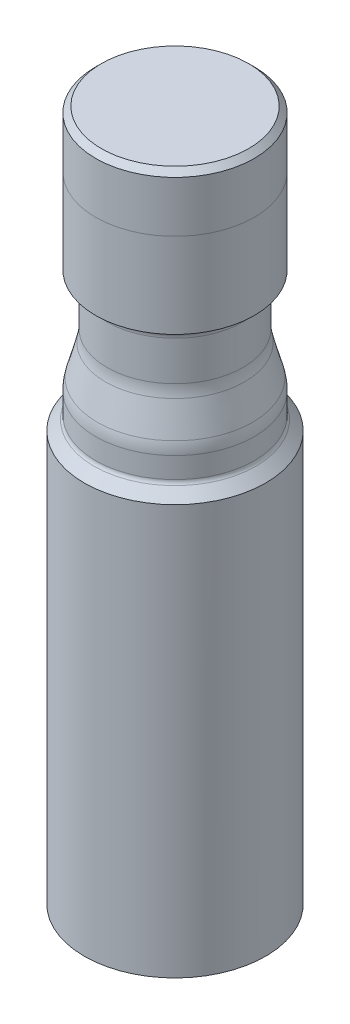
from build123d import *

# Parameters (mm, degrees)
CHAMFER1_SIZE = 5
FILLET1_R     = 10
FILLET2_R     = 40
FILLET3_R     = 5


with BuildPart() as part:
    # Sketch25 → Revolve1 (revolve)
    with BuildSketch(Plane.XY, mode=Mode.PRIVATE) as revolve1_sk:
        Polygon((180, 60), (260, 60), (260, 421.608554244), (250, 431.608554244), (250, 457.288046169), (240, 494.608554244), (240, 544.608554244), (250, 544.608554244), (250, 669.608554244), (180, 669.608554244), align=None)
    revolve(revolve1_sk.sketch.rotate(Axis((180, 669.608554244, 0), (0, -1, 0)), 90), axis=Axis((180, 669.608554244, 0), (0, -1, 0)))

    # Chamfer1
    chamfer1_edges = [part.edges().sort_by_distance(p)[0] for p in [
        (180, 669.608554244, -70),
    ]]
    chamfer(chamfer1_edges, length=CHAMFER1_SIZE)

    # Fillet1
    fillet1_edges = [part.edges().sort_by_distance(p)[0] for p in [
        (180, 544.608554244, -60),
    ]]
    fillet(fillet1_edges, radius=FILLET1_R - 0.0001)  # a hair under: the kernel refuses the full size

    # Fillet2
    fillet2_edges = [part.edges().sort_by_distance(p)[0] for p in [
        (180, 494.608554244, -60),
        (180, 457.288046169, -70),
    ]]
    fillet(fillet2_edges, radius=FILLET2_R)

    # Fillet3
    fillet3_edges = [part.edges().sort_by_distance(p)[0] for p in [
        (180, 431.608554244, -70),
    ]]
    fillet(fillet3_edges, radius=FILLET3_R)


solid = part.part
